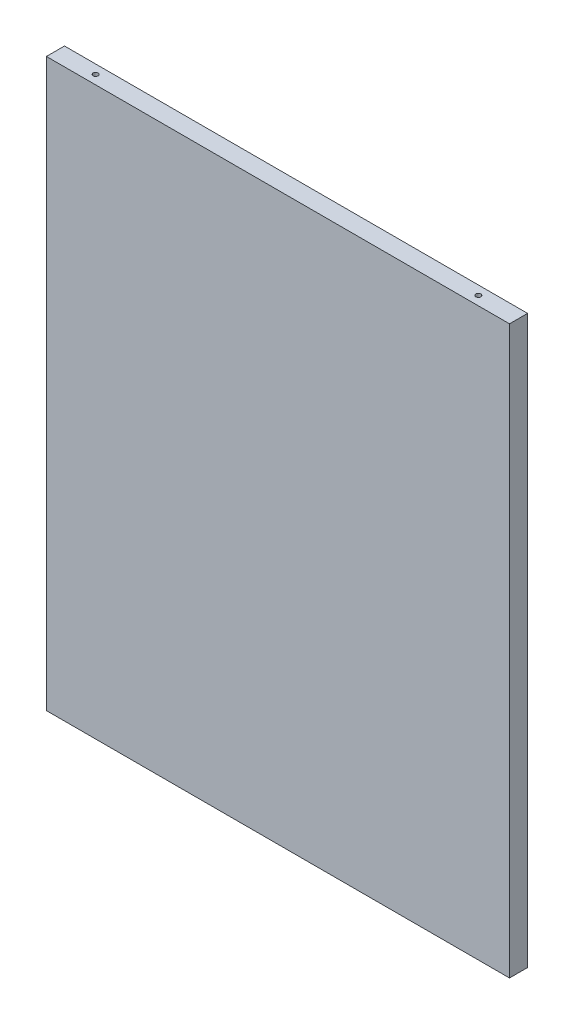
from build123d import *

# Parameters (mm, degrees)
SKETCH_1_W            = 461
SKETCH_1_H            = 564
EXTRUDE_5906_DEPTH    = 18
SKETCH_11_R           = 2.5
CUT_EXTRUDE_1_DEPTH   = 37
SKETCH_12_R           = 2.5
CUT_EXTRUDE_2_DEPTH   = 37
CUT_EXTRUDE_START     = -37
SKETCH_19_R           = 2.5
CUT_EXTRUDE_1_2_DEPTH = 37
SKETCH_20_R           = 2.5
CUT_EXTRUDE_2_2_DEPTH = 37


with BuildPart() as part:
    # Эскиз1 → Extrude 5906 (new body)
    with BuildSketch(Plane.XY):
        with Locations((230.5, 282)):
            Rectangle(SKETCH_1_W, SKETCH_1_H)
    extrude(amount=EXTRUDE_5906_DEPTH)

    # Эскиз11 → Cut-Extrude 1 (cut)
    with BuildSketch(Plane(origin=(0, 564, 0), x_dir=(1, 0, 0), z_dir=(0, 1, 0))):
        with Locations((40, -9)):
            Circle(SKETCH_11_R)
    extrude(amount=-CUT_EXTRUDE_1_DEPTH, mode=Mode.SUBTRACT)

    # Эскиз12 → Cut-Extrude 2 (cut)
    with BuildSketch(Plane(origin=(0, 564, 0), x_dir=(1, 0, 0), z_dir=(0, 1, 0))):
        with Locations((421, -9)):
            Circle(SKETCH_12_R)
    extrude(amount=-CUT_EXTRUDE_2_DEPTH, mode=Mode.SUBTRACT)

    # Эскиз19 → Cut-Extrude 1 2 (cut)
    with BuildSketch(Plane.XZ.offset(CUT_EXTRUDE_START)):
        with Locations((421, 9)):
            Circle(SKETCH_19_R)
    extrude(amount=CUT_EXTRUDE_1_2_DEPTH, mode=Mode.SUBTRACT)

    # Эскиз20 → Cut-Extrude 2 2 (cut)
    with BuildSketch(Plane.XZ.offset(CUT_EXTRUDE_START)):
        with Locations((40, 9)):
            Circle(SKETCH_20_R)
    extrude(amount=CUT_EXTRUDE_2_2_DEPTH, mode=Mode.SUBTRACT)


solid = part.part
